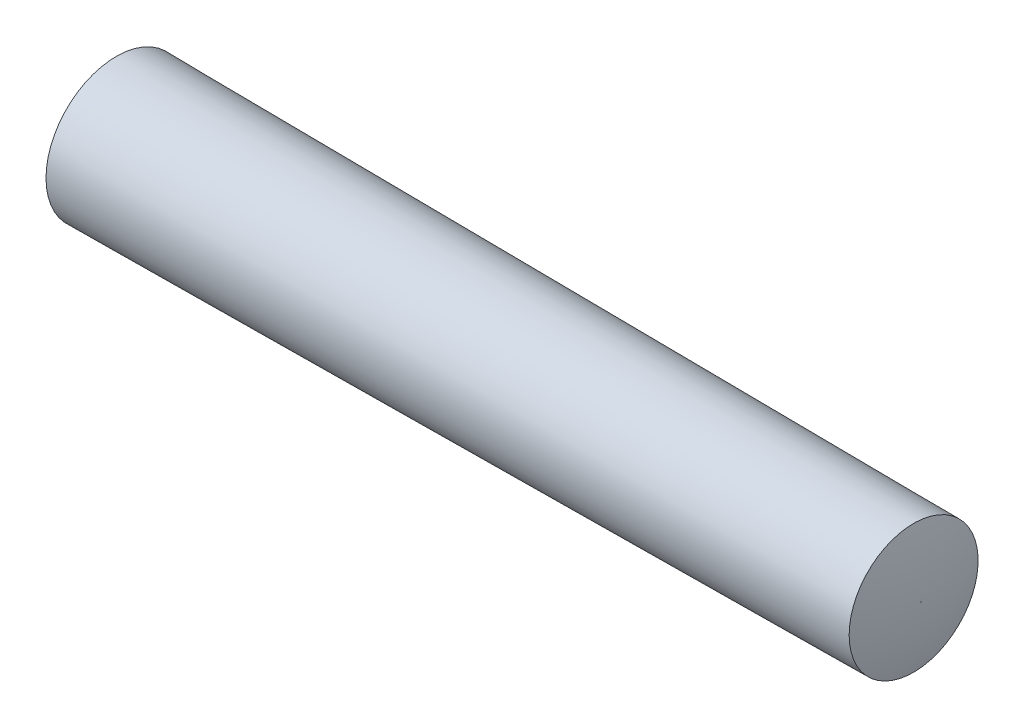
from build123d import *


with BuildPart() as part:
    # Sketch1 → Base-Revolve (revolve)
    with BuildSketch(Plane.XY):
        with BuildLine():
            Line((0, 0), (0, 0.089662))
            ThreePointArc((0, 0.089662), (0.28005076, 4.562860025), (1.11582948, 8.9662))
            Line((1.11582948, 8.9662), (102.71582948, 8.219016667))
            ThreePointArc((102.71582948, 8.219016667), (103.415171437, 4.181048768), (103.649304402, 0.089662))
            Line((103.649304402, 0.089662), (103.649304402, 0))
            Line((103.649304402, 0), (0, 0))
        make_face()
    revolve(axis=Axis((-5.588, 0, 0), (1, 0, 0)))


solid = part.part
